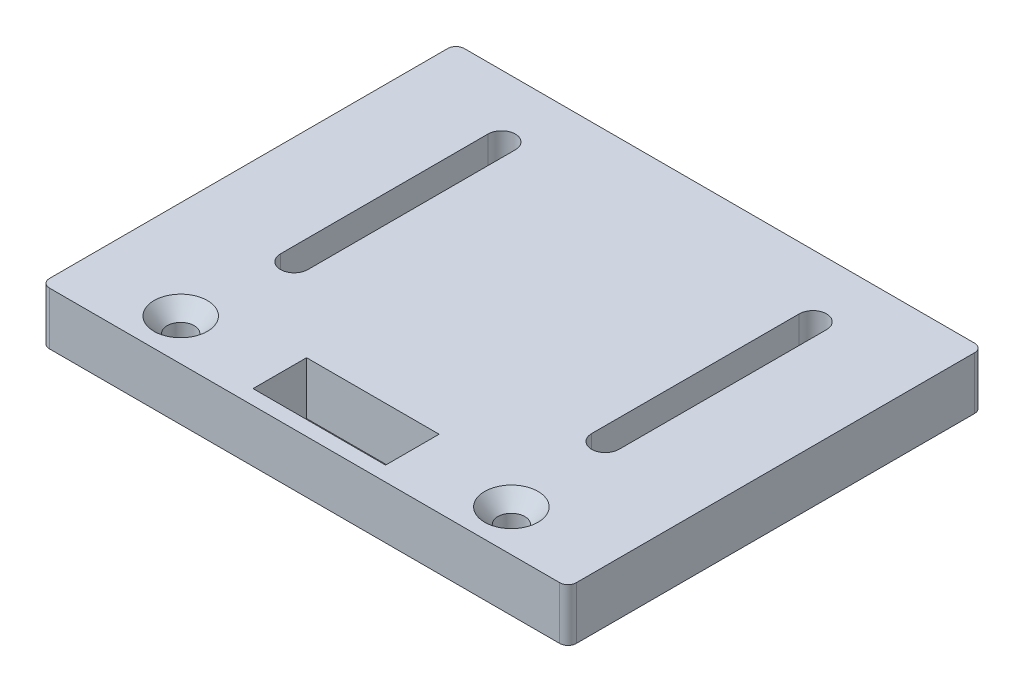
from build123d import *

# Parameters (mm, degrees)
SKETCH1_W                                        = 127
SKETCH1_H                                        = 100
BOSS_EXTRUDE1_DEPTH                              = 12.7
CUT_EXTRUDE1_DEPTH                               = 12.7
CUT_EXTRUDE2_DEPTH                               = 163.142807426
FILLET1_R                                        = 2
CSK_FOR_1_4_FLAT_HEAD_MACHINE_SCREW1_D           = 6.5278
CSK_FOR_1_4_FLAT_HEAD_MACHINE_SCREW1_CSINK_D     = 12.8778
CSK_FOR_1_4_FLAT_HEAD_MACHINE_SCREW1_CSINK_ANGLE = 82


with BuildPart() as part:
    # Sketch1 → Boss-Extrude1 (new body)
    with BuildSketch(Plane(origin=(0, 0, 0), x_dir=(1, 0, 0), z_dir=(0, 1, 0))):
        with Locations((63.5, 50)):
            Rectangle(SKETCH1_W, SKETCH1_H)
    extrude(amount=BOSS_EXTRUDE1_DEPTH)

    # Sketch2 → Cut-Extrude1 (cut)
    with BuildSketch(Plane(origin=(0, 12.7, 0), x_dir=(1, 0, 0), z_dir=(0, 1, 0))):
        Polygon((47.53, 10), (47.53, 16.45), (79.48, 16.45), (79.48, 10), (79.48, 3.55), (47.53, 3.55), align=None)
    extrude(amount=-CUT_EXTRUDE1_DEPTH, mode=Mode.SUBTRACT)

    # Sketch6 → Cut-Extrude2 (cut, through all)
    with BuildSketch(Plane(origin=(0, 12.7, 0), x_dir=(1, 0, 0), z_dir=(0, 1, 0))):
        with BuildLine():
            Line((22.7, 35), (22.7, 85))
            ThreePointArc((22.7, 85), (26, 88.3), (29.3, 85))
            Line((29.3, 85), (29.3, 35))
            ThreePointArc((29.3, 35), (26, 31.7), (22.7, 35))
        make_face()
        with BuildLine():
            Line((97.721270275, 34.979203261), (97.751665409, 84.979194023))
            ThreePointArc((97.751665409, 84.979194023), (101.053670878, 88.277187334), (104.351664189, 84.975181865))
            Line((104.351664189, 84.975181865), (104.321269055, 34.975191104))
            ThreePointArc((104.321269055, 34.975191104), (101.019263586, 31.677197792), (97.721270275, 34.979203261))
        make_face()
    extrude(amount=-CUT_EXTRUDE2_DEPTH, mode=Mode.SUBTRACT)

    # Fillet1
    fillet1_edges = [part.edges().sort_by_distance(p)[0] for p in [
        (127, 6.35, -100),
        (127, 6.35, 0),
        (0, 6.35, 0),
        (0, 6.35, -100),
    ]]
    fillet(fillet1_edges, radius=FILLET1_R)

    # CSK for 1/4 Flat Head Machine Screw1 (through all)
    with Locations(Plane(origin=(23.65, 12.7, -9.996892397), x_dir=(0, 0, 1), z_dir=(0, 1, 0))):
        with Locations((0, 0), (0, 79.7)):
            CounterSinkHole(CSK_FOR_1_4_FLAT_HEAD_MACHINE_SCREW1_D / 2, CSK_FOR_1_4_FLAT_HEAD_MACHINE_SCREW1_CSINK_D / 2, counter_sink_angle=CSK_FOR_1_4_FLAT_HEAD_MACHINE_SCREW1_CSINK_ANGLE)


solid = part.part
